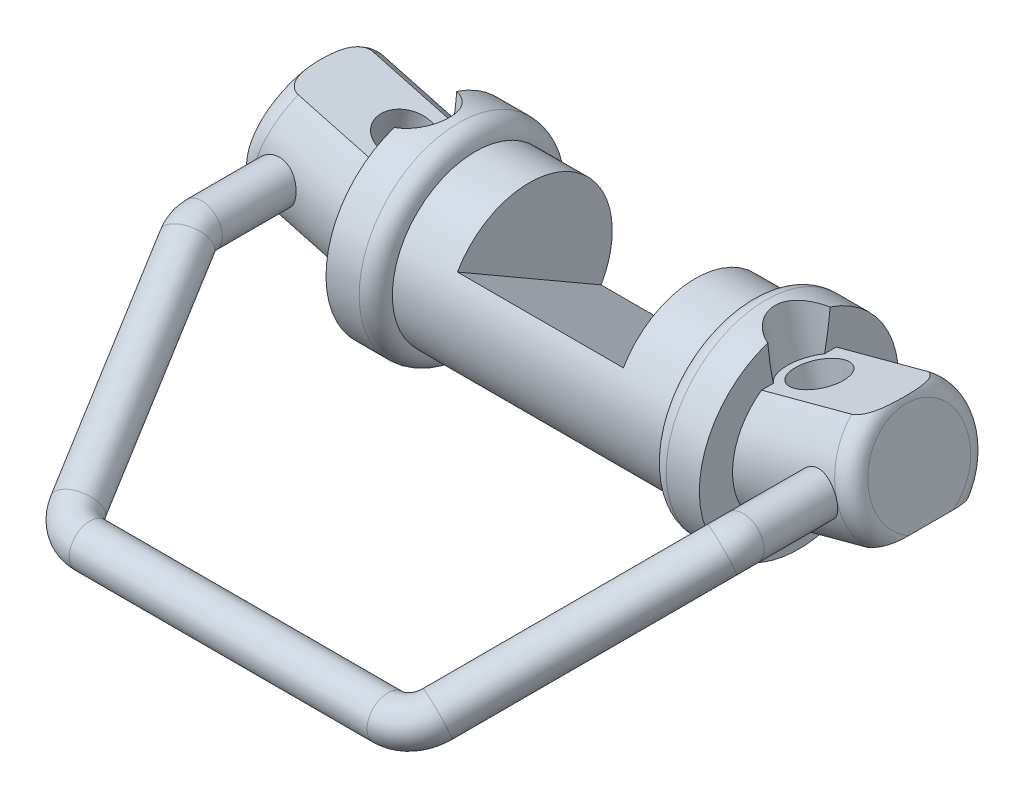
from build123d import *

# Parameters (mm, degrees)
SKETCH3_R                           = 10
BOSS_EXTRUDE1_DEPTH                 = 22.5
BOSS_EXTRUDE2_START                 = -22.5
SKETCH5_R                           = 12
BOSS_EXTRUDE2_DEPTH                 = 6
BOSS_EXTRUDE3_START                 = 16.5
SKETCH5_2_R                         = 12
BOSS_EXTRUDE3_DEPTH                 = 6
FILLET1_R                           = 2
BOSS_EXTRUDE4_START                 = -2
BOSS_EXTRUDE4_DEPTH                 = 17
FILLET2_R                           = 2
FILLET2_OF_MIRROR1_R                = 2
CUT_EXTRUDE1_REACH                  = 43.967
CUT_EXTRUDE1_END_RADIUS             = 10
CUT_EXTRUDE1_DIRECTION_2_REACH      = 43.967
CUT_EXTRUDE1_DIRECTION_2_END_RADIUS = 10
SKETCH8_R                           = 2.500000000000002
CUT_EXTRUDE2_REACH                  = 64.515
SKETCH9_R                           = 3.000000000000001
CUT_EXTRUDE2_DIRECTION_2_REACH      = 64.515
CUT_EXTRUDE3_REACH                  = 64.515
SKETCH10_R                          = 3.000000000000001
CUT_EXTRUDE3_DIRECTION_2_REACH      = 64.515
CUT_EXTRUDE4_REACH                  = 64.515
CUT_EXTRUDE4_END_RADIUS             = 12.000000000000002
SKETCH9_3_R                         = 3.999999999999999
SKETCH9_3_R_2                       = 3.000000000000001
CUT_EXTRUDE5_REACH                  = 64.515
CUT_EXTRUDE5_END_RADIUS             = 12.000000000000002
SKETCH10_3_R                        = 3.999999999999999
SKETCH10_3_R_2                      = 3.000000000000001


# Some blends are built 0.0001 mm under size
with BuildPart() as part:
    # Sketch3 → Boss-Extrude1 (new, symmetric)
    with BuildSketch(Plane(origin=(0, 0, 0), x_dir=(0, 0, -1), z_dir=(1, 0, 0))):
        with Locations(Location((0, 0, 0), (0, 0, 180))):
            Circle(SKETCH3_R)
    extrude(amount=BOSS_EXTRUDE1_DEPTH, both=True)

    # Sketch5 → Boss-Extrude2 (add)
    with BuildSketch(Plane(origin=(0, 0, 0), x_dir=(0, 0, -1), z_dir=(1, 0, 0)).offset(BOSS_EXTRUDE2_START)):
        Circle(SKETCH5_R)
    extrude(amount=BOSS_EXTRUDE2_DEPTH)

    # Sketch5<2> → Boss-Extrude3 (add)
    with BuildSketch(Plane(origin=(0, 0, 0), x_dir=(0, 0, -1), z_dir=(1, 0, 0)).offset(BOSS_EXTRUDE3_START)):
        Circle(SKETCH5_2_R)
    extrude(amount=BOSS_EXTRUDE3_DEPTH)

    # Fillet1
    fillet1_edges = [part.edges().sort_by_distance(p)[0] for p in [
        (16.5, 1.47e-15, 12),
        (-16.5, 1.47e-15, 12),
    ]]
    fillet(fillet1_edges, radius=FILLET1_R - 0.0001)  # a hair under: the kernel refuses the full size

    # Sketch6 → Boss-Extrude4 (add)
    with BuildSketch(Plane(origin=(-20.992785792574967, 5.624999999999944, 0), x_dir=(0, 0, 1), z_dir=(-0.9659258262890691, 0.25881904510251796, 0)).offset(BOSS_EXTRUDE4_START)):
        with BuildLine():
            ThreePointArc((-4.499999999999999, 0.7909497628548223), (-7.944904864452854, -4.886152304293779), (-5.915663839661229, -11.209050237145178))
            Line((-5.915663839661229, -11.209050237145178), (5.915663839661229, -11.209050237145178))
            ThreePointArc((5.915663839661229, -11.209050237145178), (7.460740938984873, -8.710874556095584), (8, -5.823428514806657))
            ThreePointArc((8, -5.823428514806655), (7.0710678118654755, -2.081771128032713), (4.5, 0.7909497628548214))
            Line((4.5, 0.7909497628548219), (-4.5, 0.7909497628548219))
        make_face()
    boss_extrude4 = extrude(amount=BOSS_EXTRUDE4_DEPTH)

    # Fillet2
    # the kernel refuses this fillet: 2 mm, written as the material it takes off along each edge
    with BuildSketch(Plane(origin=(-36.98888739433603, 3.882285676537771, 7.99e-15), x_dir=(0.2587183771189647, 0.9655501282597527, -0.027888190305296125), z_dir=(-0.007217994784454129, -0.026937923264349944, -0.9996110487792219))) as fillet2_piece_1:
        with BuildLine():
            CenterArc((8.000000000000012 - FILLET2_R, 1.00283e-12 + FILLET2_R), FILLET2_R, 270.00000000000006, 89.99999999999989)
            Line((8.000000000000012 - FILLET2_R, 9.9767e-13), (8.000000000000012, 1.00283e-12))
            Line((8.000000000000012, 1.00283e-12), (8.00000000000001, 1.00283e-12 + FILLET2_R))
        make_face()
    revolve(axis=Axis((-36.98888739433603, 3.882285676537771, 7.99e-15), (0.9659258262890692, -0.25881904510251774, 0)), revolution_arc=169.73976769975488, mode=Mode.SUBTRACT)
    with BuildSketch(Plane(origin=(-36.98888739433603, 3.8822856765377667, 4e-15), x_dir=(0.25871837711896445, 0.9655501282597528, 0.02788819030529415), z_dir=(-0.007217994784453544, -0.026937923264348056, 0.9996110487792219))) as fillet2_piece_2:
        with BuildLine():
            CenterArc((8.000000000000002 - FILLET2_R, -FILLET2_R), FILLET2_R, 6.361e-14, 89.99999999999994)
            Line((8.000000000000002 - FILLET2_R, -8.9174e-13), (8.000000000000002, -8.9041e-13))
            Line((8.000000000000002, -8.9041e-13), (8.000000000000004, -FILLET2_R))
        make_face()
    revolve(axis=Axis((-36.98888739433603, 3.8822856765377667, 4e-15), (-0.9659258262890691, 0.25881904510251796, 0)), revolution_arc=169.73976769975465, mode=Mode.SUBTRACT)

    # Mirror1: Boss-Extrude4 across plane
    add(boss_extrude4.mirror(Plane(origin=(0, 0, 0), x_dir=(0, 0, 1), z_dir=(1, 0, 0))))

    # Fillet2 of Mirror1
    # the kernel refuses this fillet: 2 mm, written as the material it takes off along each edge
    with BuildSketch(Plane(origin=(36.98888739433603, 3.882285676537771, 7.99e-15), x_dir=(-0.2587183771189647, 0.9655501282597527, -0.027888190305296125), z_dir=(0.007217994784454129, -0.026937923264349944, -0.9996110487792219))) as fillet2_of_mirror1_piece_1:
        with BuildLine():
            CenterArc((8.000000000000014 - FILLET2_OF_MIRROR1_R, -FILLET2_OF_MIRROR1_R), FILLET2_OF_MIRROR1_R, 5.725e-14, 89.99999999999989)
            Line((8.000000000000014 - FILLET2_OF_MIRROR1_R, 7.8276e-13), (8.000000000000014, 7.776e-13))
            Line((8.000000000000014, 7.776e-13), (8.000000000000012, -FILLET2_OF_MIRROR1_R))
        make_face()
    revolve(axis=Axis((36.98888739433603, 3.882285676537771, 7.99e-15), (0.9659258262890692, 0.25881904510251774, 0)), revolution_arc=169.73976769975488, mode=Mode.SUBTRACT)
    with BuildSketch(Plane(origin=(36.98888739433604, 3.882285676537766, 4e-15), x_dir=(-0.2587183771189636, 0.965550128259753, 0.027888190305294047), z_dir=(0.0072179947844535726, -0.026937923264347942, 0.9996110487792218))) as fillet2_of_mirror1_piece_2:
        with BuildLine():
            CenterArc((8.000000000000004 - FILLET2_OF_MIRROR1_R, 1.02836e-12 + FILLET2_OF_MIRROR1_R), FILLET2_OF_MIRROR1_R, 270.00000000000006, 89.99999999999994)
            Line((8.000000000000004 - FILLET2_OF_MIRROR1_R, 1.02808e-12), (8.000000000000004, 1.02836e-12))
            Line((8.000000000000004, 1.02836e-12), (8.000000000000004, 1.02836e-12 + FILLET2_OF_MIRROR1_R))
        make_face()
    revolve(axis=Axis((36.98888739433604, 3.882285676537766, 4e-15), (-0.9659258262890691, -0.258819045102518, 0)), revolution_arc=169.73976769975462, mode=Mode.SUBTRACT)

    # Cut-Extrude1: up to this cylinder (the profile starts inside it)
    cut_extrude1_end = Plane(origin=(0, 0, 0), z_dir=(-1, 0, 0)) * Cylinder(CUT_EXTRUDE1_END_RADIUS, 108.934, mode=Mode.PRIVATE)
    # Sketch7 → Cut-Extrude1 (cut, up to the surface)
    with BuildSketch(Plane(origin=(0, 0, 0), x_dir=(1, 0, 0), z_dir=(0, 0.500000000000001, 0.866025403784438)), mode=Mode.PRIVATE) as cut_extrude1_sk1:
        Polygon((10, -1.22e-15), (-10, -1.22e-15), (-10.000000000000002, 10.000000000000002), (10.000000000000002, 10.000000000000002), align=None)
    cut_extrude1_tool1 = extrude(cut_extrude1_sk1.sketch, amount=-CUT_EXTRUDE1_REACH, mode=Mode.PRIVATE) & cut_extrude1_end
    add(cut_extrude1_tool1.solids().sort_by_distance((0, 4.330127, -2.5))[0], mode=Mode.SUBTRACT)

    # Cut-Extrude1 direction 2: up to this cylinder (the profile starts inside it)
    cut_extrude1_direction_2_end = Plane(origin=(0, 0, 0), z_dir=(-1, 0, 0)) * Cylinder(CUT_EXTRUDE1_DIRECTION_2_END_RADIUS, 108.934, mode=Mode.PRIVATE)
    # Sketch7 → Cut-Extrude1 direction 2 (cut, up to the surface)
    with BuildSketch(Plane(origin=(0, 0, 0), x_dir=(1, 0, 0), z_dir=(0, 0.500000000000001, 0.866025403784438)), mode=Mode.PRIVATE) as cut_extrude1_direction_2_sk1:
        Polygon((10, -1.22e-15), (-10, -1.22e-15), (-10.000000000000002, 10.000000000000002), (10.000000000000002, 10.000000000000002), align=None)
    cut_extrude1_direction_2_tool1 = extrude(cut_extrude1_direction_2_sk1.sketch, amount=CUT_EXTRUDE1_DIRECTION_2_REACH, mode=Mode.PRIVATE) & cut_extrude1_direction_2_end
    add(cut_extrude1_direction_2_tool1.solids().sort_by_distance((0, 4.330127, -2.5))[0], mode=Mode.SUBTRACT)

    # Sweep1: sweep along a curve in space
    with BuildLine() as sweep1_path:
        Line((-32.642221176035235, 2.717599973576442, 0), (-32.642221176035235, 2.717599973576442, 16.84731284149247))
        ThreePointArc((-32.642221176035235, 2.717599973576442, 16.84731284149247), (-32.531623171410644, 2.607001968951851, 17.9549272814661), (-32.20847843014491, 2.283857227686111, 18.975921178253238))
        Line((-32.20847843014491, 2.283857227686111, 18.975921178253238), (-21.655474351497375, -8.26914685096142, 42.72018035521019))
        ThreePointArc((-21.655474351497375, -8.26914685096142, 42.72018035521019), (-20.18322604872181, -9.005485979416132, 44.376943394233294), (-17.949463925940496, -9.282400026423558, 45))
        Line((-17.949463925940496, -9.282400026423558, 45), (17.9494639259405, -9.282400026423558, 45))
        ThreePointArc((21.655474351497375, -8.26914685096142, 42.72018035521019), (20.183226048721814, -9.00548597941613, 44.376943394233294), (17.9494639259405, -9.282400026423558, 45))
        Line((32.20847843014491, 2.283857227686111, 18.975921178253238), (21.655474351497375, -8.26914685096142, 42.72018035521019))
        ThreePointArc((32.642221176035235, 2.717599973576442, 16.84731284149247), (32.531623171410644, 2.607001968951851, 17.9549272814661), (32.20847843014491, 2.283857227686111, 18.975921178253238))
        Line((32.642221176035235, 2.717599973576442, 0), (32.642221176035235, 2.717599973576442, 16.84731284149247))
    # Sketch8 → Sweep1 (sweep)
    with BuildSketch(Plane.XY):
        with Locations((-32.642221176035235, 2.717599973576442)):
            Circle(SKETCH8_R)
    sweep(path=sweep1_path.line)

    # Sketch9 → Cut-Extrude2 (cut, up to next)
    with BuildSketch(Plane(origin=(0.20471286234614847, 0.7639988032386886, 0), x_dir=(0.9659258262890691, -0.25881904510251796, 0), z_dir=(0.25881904510251796, 0.9659258262890691, 0)), mode=Mode.PRIVATE) as cut_extrude2_sk1:
        with Locations((-26.0543797164392, -2.125e-14)):
            Circle(SKETCH9_R)
    cut_extrude2_tool1 = extrude(cut_extrude2_sk1.sketch, amount=-CUT_EXTRUDE2_REACH, mode=Mode.PRIVATE) & part.part
    add(cut_extrude2_tool1.solids().sort_by_distance((-24.961885, 7.507368, 0))[0], mode=Mode.SUBTRACT)

    # Sketch9 → Cut-Extrude2 direction 2 (cut, up to next)
    with BuildSketch(Plane(origin=(0.20471286234614847, 0.7639988032386886, 0), x_dir=(0.9659258262890691, -0.25881904510251796, 0), z_dir=(0.25881904510251796, 0.9659258262890691, 0)), mode=Mode.PRIVATE) as cut_extrude2_direction_2_sk1:
        with Locations((-26.0543797164392, -2.125e-14)):
            Circle(SKETCH9_R)
    cut_extrude2_direction_2_tool1 = extrude(cut_extrude2_direction_2_sk1.sketch, amount=CUT_EXTRUDE2_DIRECTION_2_REACH, mode=Mode.PRIVATE) & part.part
    add(cut_extrude2_direction_2_tool1.solids().sort_by_distance((-24.961885, 7.507368, 0))[0], mode=Mode.SUBTRACT)

    # Sketch10 → Cut-Extrude3 (cut, up to next)
    with BuildSketch(Plane(origin=(-0.20471286234614847, 0.7639988032386886, 0), x_dir=(0.9659258262890691, 0.25881904510251796, 0), z_dir=(-0.25881904510251796, 0.9659258262890691, 0)), mode=Mode.PRIVATE) as cut_extrude3_sk1:
        with Locations(Location((26.05437971643834, -3.903e-14, 0), (0, 0, 244.422045679))):
            Circle(SKETCH10_R)
    cut_extrude3_tool1 = extrude(cut_extrude3_sk1.sketch, amount=-CUT_EXTRUDE3_REACH, mode=Mode.PRIVATE) & part.part
    add(cut_extrude3_tool1.solids().sort_by_distance((24.961885, 7.507368, 0))[0], mode=Mode.SUBTRACT)

    # Sketch10 → Cut-Extrude3 direction 2 (cut, up to next)
    with BuildSketch(Plane(origin=(-0.20471286234614847, 0.7639988032386886, 0), x_dir=(0.9659258262890691, 0.25881904510251796, 0), z_dir=(-0.25881904510251796, 0.9659258262890691, 0)), mode=Mode.PRIVATE) as cut_extrude3_direction_2_sk1:
        with Locations(Location((26.05437971643834, -3.903e-14, 0), (0, 0, 244.422045679))):
            Circle(SKETCH10_R)
    cut_extrude3_direction_2_tool1 = extrude(cut_extrude3_direction_2_sk1.sketch, amount=CUT_EXTRUDE3_DIRECTION_2_REACH, mode=Mode.PRIVATE) & part.part
    add(cut_extrude3_direction_2_tool1.solids().sort_by_distance((24.961885, 7.507368, 0))[0], mode=Mode.SUBTRACT)

    # Cut-Extrude4: up to this cylinder (the profile starts inside it)
    cut_extrude4_end = Plane(origin=(-28.716307, 0, 0), z_dir=(-1, 0, 0)) * Cylinder(CUT_EXTRUDE4_END_RADIUS, 154.03, mode=Mode.PRIVATE)
    # Sketch9<3> → Cut-Extrude4 (cut, up to the surface)
    with BuildSketch(Plane(origin=(0.20471286234614847, 0.7639988032386886, 0), x_dir=(0.9659258262890691, -0.25881904510251796, 0), z_dir=(0.25881904510251796, 0.9659258262890691, 0)), mode=Mode.PRIVATE) as cut_extrude4_sk1:
        with Locations((-26.0543797164392, -2.125e-14)):
            Circle(SKETCH9_3_R)
        with Locations((-26.0543797164392, -2.125e-14)):
            Circle(SKETCH9_3_R_2, mode=Mode.SUBTRACT)
    cut_extrude4_tool1 = extrude(cut_extrude4_sk1.sketch, amount=CUT_EXTRUDE4_REACH, mode=Mode.PRIVATE) & cut_extrude4_end
    add(cut_extrude4_tool1.solids().sort_by_distance((-28.716307, 8.513363, 0))[0], mode=Mode.SUBTRACT)

    # Cut-Extrude5: up to this cylinder (the profile starts inside it)
    cut_extrude5_end = Plane(origin=(21.20746399999997, 4.7714e-13, -5.8095e-13), z_dir=(1, -4.77e-15, -2.54e-15)) * Cylinder(CUT_EXTRUDE5_END_RADIUS, 154.03, mode=Mode.PRIVATE)
    # Sketch10<3> → Cut-Extrude5 (cut, up to the surface)
    with BuildSketch(Plane(origin=(-0.20471286234614847, 0.7639988032386886, 0), x_dir=(0.9659258262890691, 0.25881904510251796, 0), z_dir=(-0.25881904510251796, 0.9659258262890691, 0)), mode=Mode.PRIVATE) as cut_extrude5_sk1:
        with Locations((26.05437971643834, -3.903e-14)):
            Circle(SKETCH10_3_R)
        with Locations(Location((26.05437971643834, -3.903e-14, 0), (0, 0, 180))):
            Circle(SKETCH10_3_R_2, mode=Mode.SUBTRACT)
    cut_extrude5_tool1 = extrude(cut_extrude5_sk1.sketch, amount=CUT_EXTRUDE5_REACH, mode=Mode.PRIVATE) & cut_extrude5_end
    add(cut_extrude5_tool1.solids().sort_by_distance((21.207464, 6.501374, 0))[0], mode=Mode.SUBTRACT)


solid = part.part
